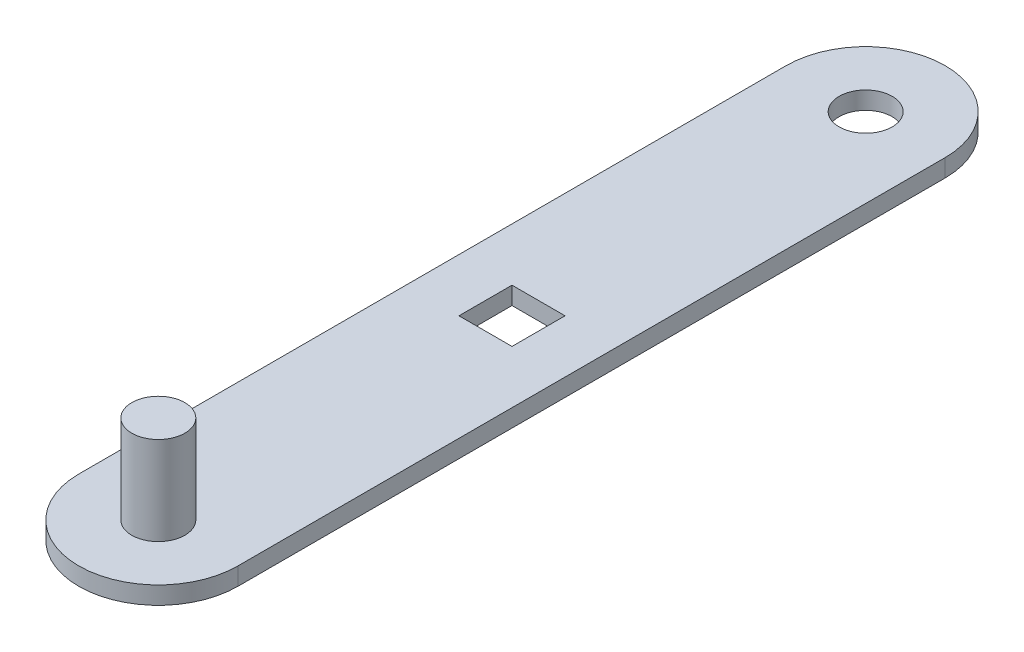
from build123d import *

# Parameters (mm, degrees)
BOSS_EXTRUDE1_DEPTH = 50
SKETCH2_R           = 75
BOSS_EXTRUDE2_DEPTH = 250
SKETCH3_R           = 75
CUT_EXTRUDE2_DEPTH  = 250
SKETCH4_W           = 150
SKETCH4_H           = 150
CUT_EXTRUDE3_DEPTH  = 1271.334601591


with BuildPart() as part:
    # Sketch1 → Boss-Extrude1 (new body)
    with BuildSketch(Plane(origin=(0, 0, 0), x_dir=(1, 0, 0), z_dir=(0, 1, 0))):
        with BuildLine():
            Line((-225, 1000), (-225, -1000))
            ThreePointArc((-225, -1000), (0, -1225), (225, -1000))
            Line((225, -1000), (225, 1000))
            ThreePointArc((225, 1000), (0, 1225), (-225, 1000))
        make_face()
    extrude(amount=BOSS_EXTRUDE1_DEPTH)

    # Sketch2 → Boss-Extrude2 (add)
    with BuildSketch(Plane(origin=(0, 50, 0), x_dir=(1, 0, 0), z_dir=(0, 1, 0))):
        with Locations((0, -1000)):
            Circle(SKETCH2_R)
    extrude(amount=BOSS_EXTRUDE2_DEPTH)

    # Sketch3 → Cut-Extrude2 (cut)
    with BuildSketch(Plane(origin=(0, 50, 0), x_dir=(1, 0, 0), z_dir=(0, 1, 0))):
        with Locations((0, 1000)):
            Circle(SKETCH3_R)
    extrude(amount=-CUT_EXTRUDE2_DEPTH, mode=Mode.SUBTRACT)

    # Sketch4 → Cut-Extrude3 (cut, through all)
    with BuildSketch(Plane(origin=(0, 50, 0), x_dir=(1, 0, 0), z_dir=(0, 1, 0))):
        Rectangle(SKETCH4_W, SKETCH4_H)
    extrude(amount=-CUT_EXTRUDE3_DEPTH, mode=Mode.SUBTRACT)


solid = part.part
